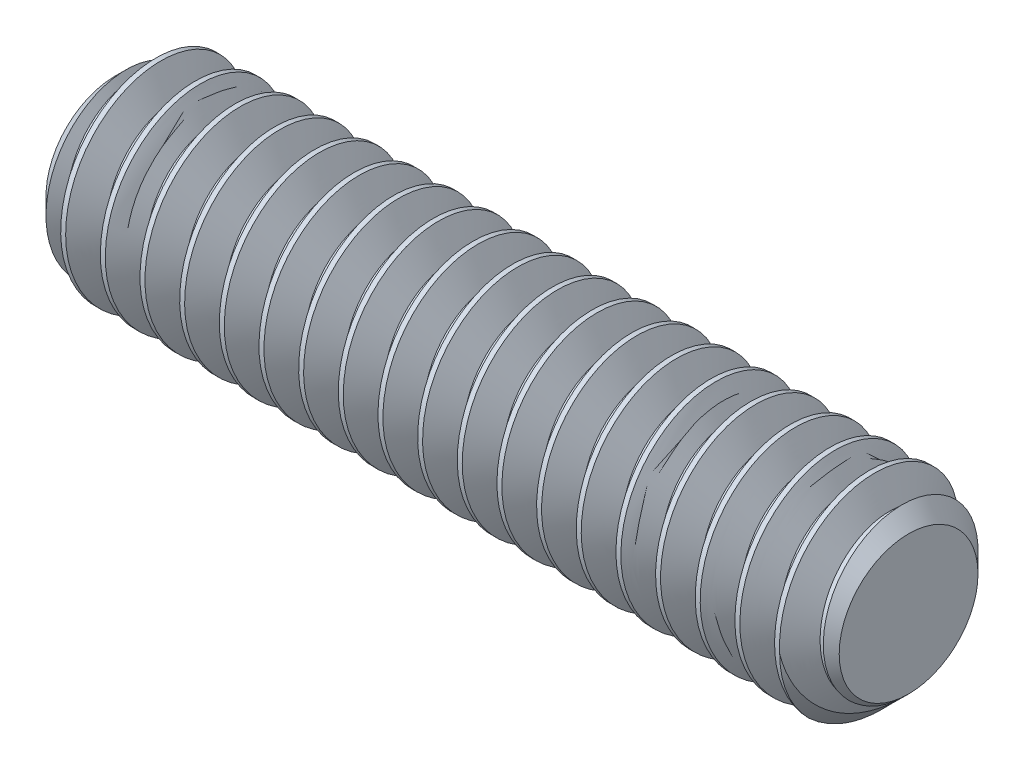
from build123d import *

# Parameters (mm, degrees)
BOSS_EXTRUDE1_DEPTH      = 12.7
BOSS_EXTRUDE1_DEPTH_BACK = 12.7
SKETCH2_R                = 3.175
CHAMFER1_SIZE            = 0.9525
CUT_SWEEP3_PITCH         = 1.27


with BuildPart() as part:
    # Sketch2 → Boss-Extrude1 (new, two sides: drawn at the far end of the back side and taken through both)
    with BuildSketch(Plane(origin=(0, 0, 0), x_dir=(0, 0, -1), z_dir=(1, 0, 0)).offset(-BOSS_EXTRUDE1_DEPTH_BACK)):
        Circle(SKETCH2_R)
    extrude(amount=BOSS_EXTRUDE1_DEPTH + BOSS_EXTRUDE1_DEPTH_BACK)

    # Chamfer1
    chamfer1_edges = [part.edges().sort_by_distance(p)[0] for p in [
        (-12.7, 0, 3.175),
        (12.7, 0, 3.175),
    ]]
    chamfer(chamfer1_edges, length=CHAMFER1_SIZE)

    # Cut-Sweep3: the profile of Sketch4 screwed along a right-hand helix of 21 turns, 8 arcs to a turn; built about Z, then put on its axis
    cut_sweep3_z = Axis((0, 0, 0), (0, 0, 1))
    cut_sweep3_corners = [(2.350110803, 0, -0.47625), (3.243740766, 0, 0.0396875), (3.243740766, 0, -1.1509375), (2.350110803, 0, -0.635)]
    with BuildLine(mode=Mode.PRIVATE) as cut_sweep3_profile:
        Line(cut_sweep3_corners[0], cut_sweep3_corners[1])
        Line(cut_sweep3_corners[1], cut_sweep3_corners[2])
        Line(cut_sweep3_corners[2], cut_sweep3_corners[3])
        Line(cut_sweep3_corners[3], cut_sweep3_corners[0])
    cut_sweep3_cap = Face(cut_sweep3_profile.wire())
    cut_sweep3_turn_angles = [0, 22.5, 45, 67.5, 90, 112.5, 135, 157.5, 180, 202.5, 225, 247.5, 270, 292.5, 315, 337.5, 360]
    cut_sweep3_turn_weights = [1, 0.9238795325112867, 1, 0.9238795325112867, 1, 0.9238795325112867, 1, 0.9238795325112867, 1, 0.9238795325112867, 1, 0.9238795325112867, 1, 0.9238795325112867, 1, 0.9238795325112867, 1]
    cut_sweep3_turn_rails = [Edge.make_bspline([Vector(p[0], p[1], 0).rotate(cut_sweep3_z, cut_sweep3_turn_angles[k]) / cut_sweep3_turn_weights[k] + Vector(0, 0, p[2] + CUT_SWEEP3_PITCH * cut_sweep3_turn_angles[k] / 360) for k in range(17)], [0, 0, 0, 1, 1, 2, 2, 3, 3, 4, 4, 5, 5, 6, 6, 7, 7, 8, 8, 8], 2, cut_sweep3_turn_weights) for p in cut_sweep3_corners]
    cut_sweep3_turn_sides = [Face.make_surface_from_curves(cut_sweep3_turn_rails[p[0]], cut_sweep3_turn_rails[p[1]]) for p in [(0, 1), (1, 2), (2, 3), (3, 0)]]
    cut_sweep3 = Plane(origin=(12.7, 0, 0), x_dir=(0, 1, 0), z_dir=(-1, 0, 0)) * Solid(Shell([*[p.moved(Location((0, 0, CUT_SWEEP3_PITCH * i))) for i in range(21) for p in cut_sweep3_turn_sides], cut_sweep3_cap, cut_sweep3_cap.rotate(cut_sweep3_z, 7560).moved(Location((0, 0, CUT_SWEEP3_PITCH * 7560 / 360)))]))
    add(cut_sweep3, mode=Mode.SUBTRACT)


solid = part.part
